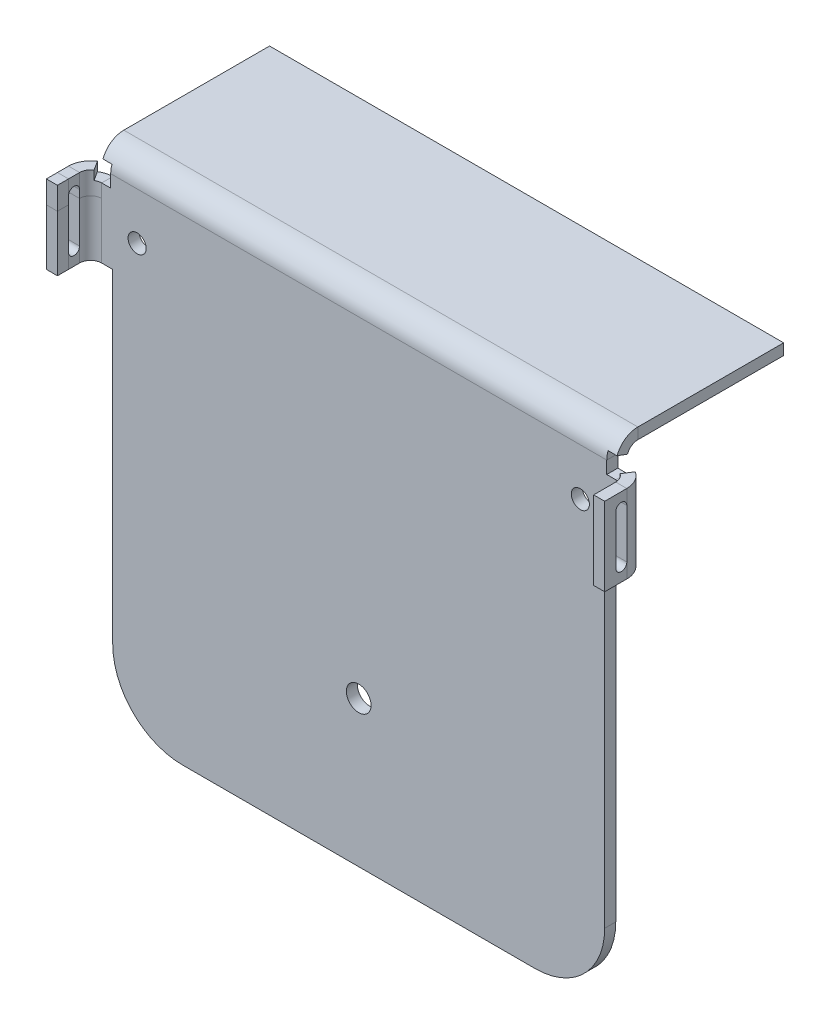
from build123d import *

# Parameters (mm, degrees)
SKETCH13_R              = 2.6
SKETCH13_R_2            = 3.55
BASE_FLANGE1_DEPTH      = 3.175
EDGE_FLANGE2_DEPTH      = 22.5
EDGE_FLANGE3_DEPTH      = 22.5
CUT_EXTRUDE3_DEPTH      = 944.619626468
CUT_EXTRUDE3_DEPTH_BACK = 944.619626468
EDGE_FLANGE4_DEPTH      = 147.523066449
CORNER_START            = 927.243279461
CORNER_RELIEF2_DEPTH    = 2.5875
CORNER_START_2          = 544.417983929
CORNER_RELIEF2_2_DEPTH  = 2.5875
CORNER_RELIEF3_DEPTH    = 2.5875
CORNER_START_3          = 689.353550378
CORNER_RELIEF3_2_DEPTH  = 2.5875


with BuildPart() as part:
    # Base-Flange1: sheet metal written as solids
    # Sketch13 → Base-Flange1 (new body)
    with BuildSketch(Plane(origin=(0, 0, 0), x_dir=(-1, 0, 0), z_dir=(0, 0, -1))):
        with BuildLine():
            Line((-547.592983929, 907.330779461), (-547.592983929, 814.180779461))
            ThreePointArc((-547.592983929, 814.180779461), (-553.450848305, 800.038643837), (-567.592983929, 794.180779461))
            Line((-567.592983929, 794.180779461), (-668.766050378, 794.180779461))
            ThreePointArc((-668.766050378, 794.180779461), (-682.908186002, 800.038643837), (-688.766050378, 814.180779461))
            Line((-688.766050378, 814.180779461), (-688.766050378, 907.330779461))
            Line((-688.766050378, 907.330779461), (-691.941050378, 907.330779461))
            Line((-691.941050378, 907.330779461), (-691.941050378, 929.830779461))
            Line((-691.941050378, 929.830779461), (-544.417983929, 929.830779461))
            Line((-544.417983929, 929.830779461), (-544.417983929, 907.330779461))
            Line((-544.417983929, 907.330779461), (-547.592983929, 907.330779461))
        make_face()
        with Locations((-681.766050378, 917.330779461)):
            Circle(SKETCH13_R, mode=Mode.SUBTRACT)
        with Locations((-618.179517153, 836.030779461)):
            Circle(SKETCH13_R_2, mode=Mode.SUBTRACT)
        with Locations((-554.592983929, 917.330779461)):
            Circle(SKETCH13_R, mode=Mode.SUBTRACT)
    extrude(amount=-BASE_FLANGE1_DEPTH)

    # Edge-Flange2: sheet metal written as solids
    # Edge-Flange2 section (on a plane across the edge) → Edge-Flange2 (add)
    with BuildSketch(Plane(origin=(695.116050378, 907.330779461, 3.175), x_dir=(-1, 0, 0), z_dir=(0, 1, 0))):
        with BuildLine():
            Line((-3.175, 3.175), (-3.175, 9.525))
            Line((-3.175, 9.525), (0, 9.525))
            Line((0, 9.525), (0, 3.175))
            ThreePointArc((0, 3.175), (0.92993597, 0.92993597), (3.175, 0))
            Line((3.175, 0), (3.175, -3.175))
            ThreePointArc((3.175, -3.175), (-1.315128061, -1.315128061), (-3.175, 3.175))
        make_face()
    extrude(amount=EDGE_FLANGE2_DEPTH)

    # Edge-Flange3: sheet metal written as solids
    # Edge-Flange3 section (on a plane across the edge) → Edge-Flange3 (add)
    with BuildSketch(Plane(origin=(541.242983929, 929.830779461, 3.175), x_dir=(1, 0, 0), z_dir=(0, -1, 0))):
        with BuildLine():
            Line((-3.175, 3.175), (-3.175, 9.525))
            Line((-3.175, 9.525), (0, 9.525))
            Line((0, 9.525), (0, 3.175))
            ThreePointArc((0, 3.175), (0.92993597, 0.92993597), (3.175, 0))
            Line((3.175, 0), (3.175, -3.175))
            ThreePointArc((3.175, -3.175), (-1.315128061, -1.315128061), (-3.175, 3.175))
        make_face()
    extrude(amount=EDGE_FLANGE3_DEPTH)

    # Sketch27 → Cut-Extrude3 (cut, two sides: drawn at the far end of the back side and taken through both)
    with BuildSketch(Plane(origin=(698.291050378, 0, 0), x_dir=(0, 0, -1), z_dir=(1, 0, 0)).offset(-CUT_EXTRUDE3_DEPTH_BACK)):
        with BuildLine():
            Line((-9.525, 911.558356296), (-9.525, 925.603202625))
            ThreePointArc((-9.525, 925.603202625), (-7.9375, 927.190702625), (-6.35, 925.603202625))
            Line((-6.35, 925.603202625), (-6.35, 911.558356296))
            ThreePointArc((-6.35, 911.558356296), (-7.9375, 909.970856296), (-9.525, 911.558356296))
        make_face()
    extrude(amount=CUT_EXTRUDE3_DEPTH + CUT_EXTRUDE3_DEPTH_BACK, mode=Mode.SUBTRACT)

    # Edge-Flange4: sheet metal written as solids
    # Edge-Flange4 section (on a plane across the edge) → Edge-Flange4 (add)
    with BuildSketch(Plane(origin=(544.417983929, 934.005779461, 0), x_dir=(0, -1, 0), z_dir=(1, 0, 0))):
        with BuildLine():
            Line((-3.175, 3.175), (-3.175, 45))
            Line((-3.175, 45), (0, 45))
            Line((0, 45), (0, 3.175))
            ThreePointArc((0, 3.175), (0.92993597, 0.92993597), (3.175, 0))
            Line((3.175, 0), (4.175, 0))
            Line((4.175, 0), (4.175, -3.175))
            Line((4.175, -3.175), (3.175, -3.175))
            ThreePointArc((3.175, -3.175), (-1.315128061, -1.315128061), (-3.175, 3.175))
        make_face()
    extrude(amount=EDGE_FLANGE4_DEPTH)

    # Corner Relief2: read off the stored shape, not the designer's step
    # Corner Relief2 outline → Corner Relief2 (cut)
    with BuildSketch(Plane(origin=(0, 0, 0), x_dir=(1, 0, 0), z_dir=(0, 1, 0)).offset(CORNER_START)):
        with BuildLine():
            Line((541.013027484, -0.990077276), (542.715505707, -3.670038638))
            ThreePointArc((542.715505707, -3.670038638), (543.531488674, -3.301270566), (544.417983929, -3.175))
            Line((544.417983929, -3.175), (544.417983929, 0))
            ThreePointArc((544.417983929, 0), (542.644993418, -0.252541132), (541.013027484, -0.990077276))
        make_face()
    extrude(amount=CORNER_RELIEF2_DEPTH, mode=Mode.SUBTRACT)

    # Corner Relief2 2 outline → Corner Relief2 2 (cut)
    with BuildSketch(Plane.YZ.offset(CORNER_START_2)):
        with BuildLine():
            Line((930.830779461, 3.175), (927.243279461, 3.175))
            Line((927.243279461, 3.175), (927.243279461, 0))
            Line((927.243279461, 0), (930.830779461, 0))
            ThreePointArc((930.830779461, 0), (931.379229895, -0.047728486), (931.911191064, -0.189478979))
            Line((931.911191064, -0.189478979), (932.991602668, 2.796042042))
            ThreePointArc((932.991602668, 2.796042042), (931.92768033, 3.079543028), (930.830779461, 3.175))
        make_face()
    extrude(amount=CORNER_RELIEF2_2_DEPTH, mode=Mode.SUBTRACT)

    # Corner Relief3: read off the stored shape, not the designer's step
    # Corner Relief3 outline → Corner Relief3 (cut)
    with BuildSketch(Plane(origin=(0, 0, 0), x_dir=(1, 0, 0), z_dir=(0, 1, 0)).offset(CORNER_START)):
        with BuildLine():
            ThreePointArc((691.941050378, -3.175), (692.827545633, -3.301270566), (693.6435286, -3.670038638))
            Line((693.6435286, -3.670038638), (695.346006823, -0.990077276))
            ThreePointArc((695.346006823, -0.990077276), (693.714040889, -0.252541132), (691.941050378, 0))
            Line((691.941050378, 0), (691.941050378, -3.175))
        make_face()
    extrude(amount=CORNER_RELIEF3_DEPTH, mode=Mode.SUBTRACT)

    # Corner Relief3 2 outline → Corner Relief3 2 (cut)
    with BuildSketch(Plane.YZ.offset(CORNER_START_3)):
        with BuildLine():
            Line((930.830779461, 3.175), (927.243279461, 3.175))
            Line((927.243279461, 3.175), (927.243279461, 0))
            Line((927.243279461, 0), (930.830779461, 0))
            ThreePointArc((930.830779461, 0), (931.379229895, -0.047728486), (931.911191064, -0.189478979))
            Line((931.911191064, -0.189478979), (932.991602668, 2.796042042))
            ThreePointArc((932.991602668, 2.796042042), (931.92768033, 3.079543028), (930.830779461, 3.175))
        make_face()
    extrude(amount=CORNER_RELIEF3_2_DEPTH, mode=Mode.SUBTRACT)


solid = part.part
